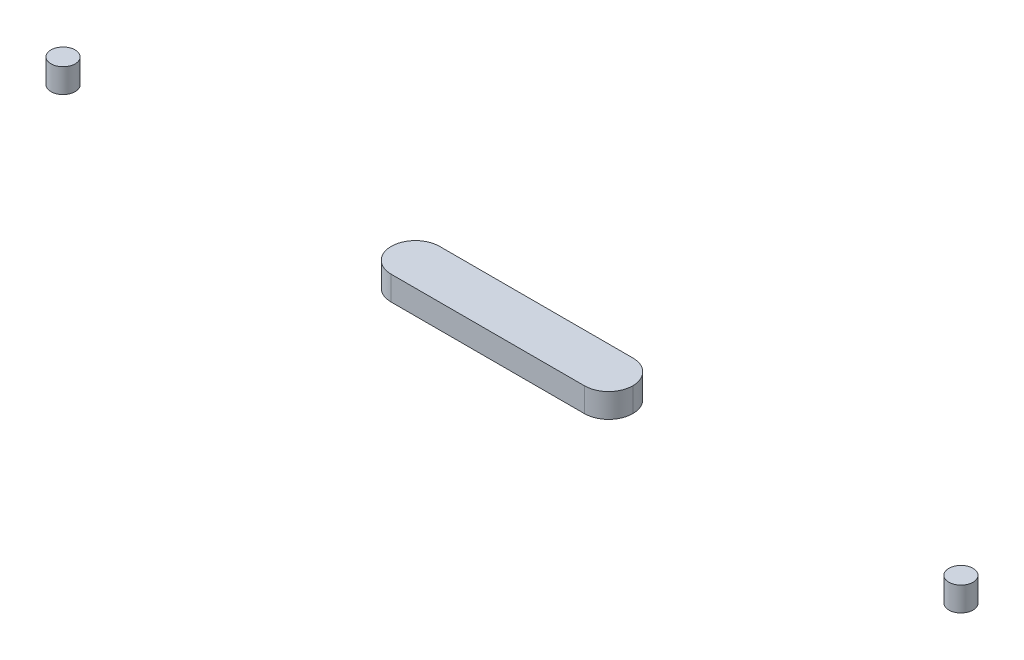
from build123d import *

# Parameters (mm, degrees)
SKETCH1_R             = 2.5
BOSS_EXTRUDE1_DEPTH   = 5
BOSS_EXTRUDE1_2_DEPTH = 5
SKETCH1_W             = 50
SKETCH1_H             = 10
BOSS_EXTRUDE1_3_DEPTH = 5
FILLET1_R             = 5


with BuildPart() as part:
    # Sketch1 → Boss-Extrude1 (new body)
    with BuildSketch(Plane(origin=(0, 0, 0), x_dir=(1, 0, 0), z_dir=(0, 1, 0))):
        with Locations(Location((-92.931552942, 0, 0), (0, 0, 270))):
            Circle(SKETCH1_R)
    extrude(amount=BOSS_EXTRUDE1_DEPTH)


with BuildPart() as body_2:
    # Sketch1 → Boss-Extrude1 2 (new body)
    with BuildSketch(Plane(origin=(0, 0, 0), x_dir=(1, 0, 0), z_dir=(0, 1, 0))):
        with Locations(Location((92.931552942, 0, 0), (0, 0, 90))):
            Circle(SKETCH1_R)
    extrude(amount=BOSS_EXTRUDE1_2_DEPTH)


with BuildPart() as body_3:
    # Sketch1 → Boss-Extrude1 3 (new body)
    with BuildSketch(Plane(origin=(0, 0, 0), x_dir=(1, 0, 0), z_dir=(0, 1, 0))):
        Rectangle(SKETCH1_W, SKETCH1_H)
    extrude(amount=BOSS_EXTRUDE1_3_DEPTH)

    # Fillet1
    fillet1_edges = [body_3.edges().sort_by_distance(p)[0] for p in [
        (-25, 2.5, -5),
        (25, 2.5, -5),
        (25, 2.5, 5),
        (-25, 2.5, 5),
    ]]
    fillet(fillet1_edges, radius=FILLET1_R - 0.0001)  # a hair under: the kernel refuses the full size


solid = Compound([part.part, body_2.part, body_3.part])
